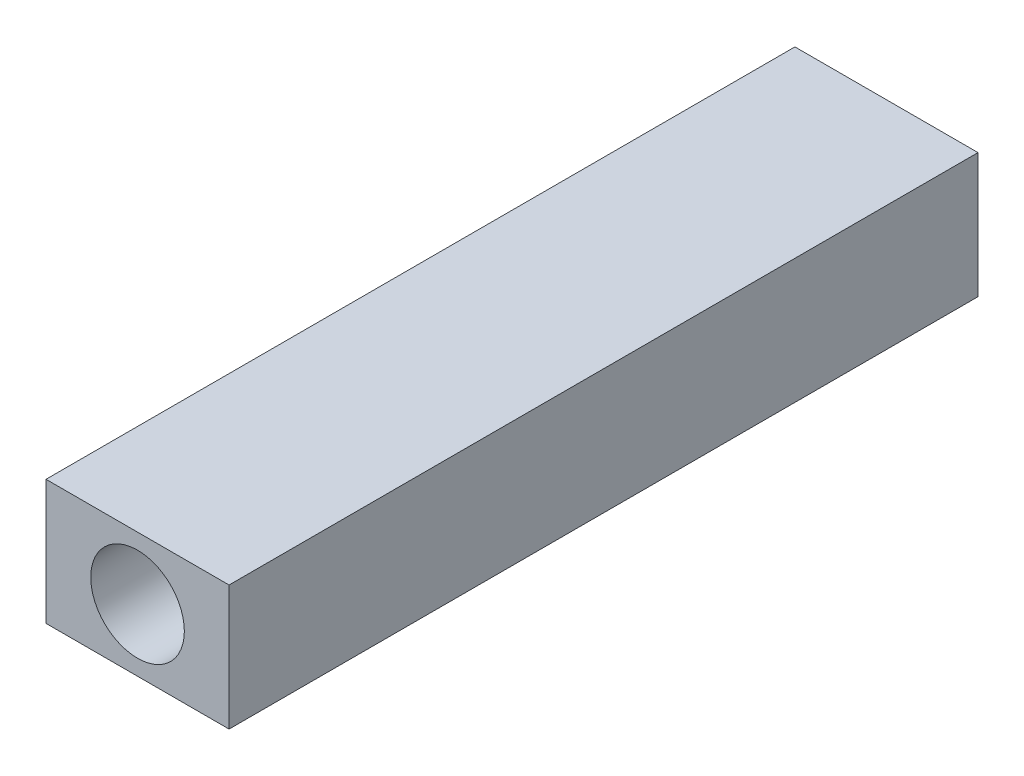
from build123d import *

# Parameters (mm, degrees)
SKETCH1_W           = 27.94
SKETCH1_H           = 19.05
BOSS_EXTRUDE1_DEPTH = 114.3
SKETCH3_R           = 5.1054
CUT_EXTRUDE2_DEPTH  = 109.011614769
CUT_EXTRUDE3_REACH  = 120.05
SKETCH4_R           = 4.445
SKETCH5_R           = 7.14375
CUT_EXTRUDE4_DEPTH  = 20.066


with BuildPart() as part:
    # Sketch1 → Boss-Extrude1 (new body)
    with BuildSketch(Plane.XY):
        Rectangle(SKETCH1_W, SKETCH1_H)
    extrude(amount=BOSS_EXTRUDE1_DEPTH)

    # Sketch3 → Cut-Extrude2 (cut, through all)
    with BuildSketch(Plane(origin=(0, 0, 7.62), x_dir=(-1, 0, 0), z_dir=(0, 0, -1))):
        Circle(SKETCH3_R)
    extrude(amount=-CUT_EXTRUDE2_DEPTH, mode=Mode.SUBTRACT)

    # Sketch4 → Cut-Extrude3 (cut, up to next)
    with BuildSketch(Plane.ZY.offset(13.97), mode=Mode.PRIVATE) as cut_extrude3_sk1:
        with Locations((16.5354, 0)):
            Circle(SKETCH4_R)
    cut_extrude3_tool1 = extrude(cut_extrude3_sk1.sketch, amount=-CUT_EXTRUDE3_REACH, mode=Mode.PRIVATE) & part.part
    # Sketch4 → Cut-Extrude3 (cut, up to next)
    with BuildSketch(Plane.ZY.offset(13.97), mode=Mode.PRIVATE) as cut_extrude3_sk2:
        with Locations((33.0454, 0)):
            Circle(SKETCH4_R)
    cut_extrude3_tool2 = extrude(cut_extrude3_sk2.sketch, amount=-CUT_EXTRUDE3_REACH, mode=Mode.PRIVATE) & part.part
    # Sketch4 → Cut-Extrude3 (cut, up to next)
    with BuildSketch(Plane.ZY.offset(13.97), mode=Mode.PRIVATE) as cut_extrude3_sk3:
        with Locations((49.5554, 0)):
            Circle(SKETCH4_R)
    cut_extrude3_tool3 = extrude(cut_extrude3_sk3.sketch, amount=-CUT_EXTRUDE3_REACH, mode=Mode.PRIVATE) & part.part
    # Sketch4 → Cut-Extrude3 (cut, up to next)
    with BuildSketch(Plane.ZY.offset(13.97), mode=Mode.PRIVATE) as cut_extrude3_sk4:
        with Locations((66.0654, 0)):
            Circle(SKETCH4_R)
    cut_extrude3_tool4 = extrude(cut_extrude3_sk4.sketch, amount=-CUT_EXTRUDE3_REACH, mode=Mode.PRIVATE) & part.part
    # Sketch4 → Cut-Extrude3 (cut, up to next)
    with BuildSketch(Plane.ZY.offset(13.97), mode=Mode.PRIVATE) as cut_extrude3_sk5:
        with Locations((82.5754, 0)):
            Circle(SKETCH4_R)
    cut_extrude3_tool5 = extrude(cut_extrude3_sk5.sketch, amount=-CUT_EXTRUDE3_REACH, mode=Mode.PRIVATE) & part.part
    add(cut_extrude3_tool1.solids().sort_by_distance((-13.97, 0, 16.5354))[0], mode=Mode.SUBTRACT)
    add(cut_extrude3_tool2.solids().sort_by_distance((-13.97, 0, 33.0454))[0], mode=Mode.SUBTRACT)
    add(cut_extrude3_tool3.solids().sort_by_distance((-13.97, 0, 49.5554))[0], mode=Mode.SUBTRACT)
    add(cut_extrude3_tool4.solids().sort_by_distance((-13.97, 0, 66.0654))[0], mode=Mode.SUBTRACT)
    add(cut_extrude3_tool5.solids().sort_by_distance((-13.97, 0, 82.5754))[0], mode=Mode.SUBTRACT)

    # Sketch5 → Cut-Extrude4 (cut)
    with BuildSketch(Plane.XY.offset(114.3)):
        Circle(SKETCH5_R)
    extrude(amount=-CUT_EXTRUDE4_DEPTH, mode=Mode.SUBTRACT)


solid = part.part
